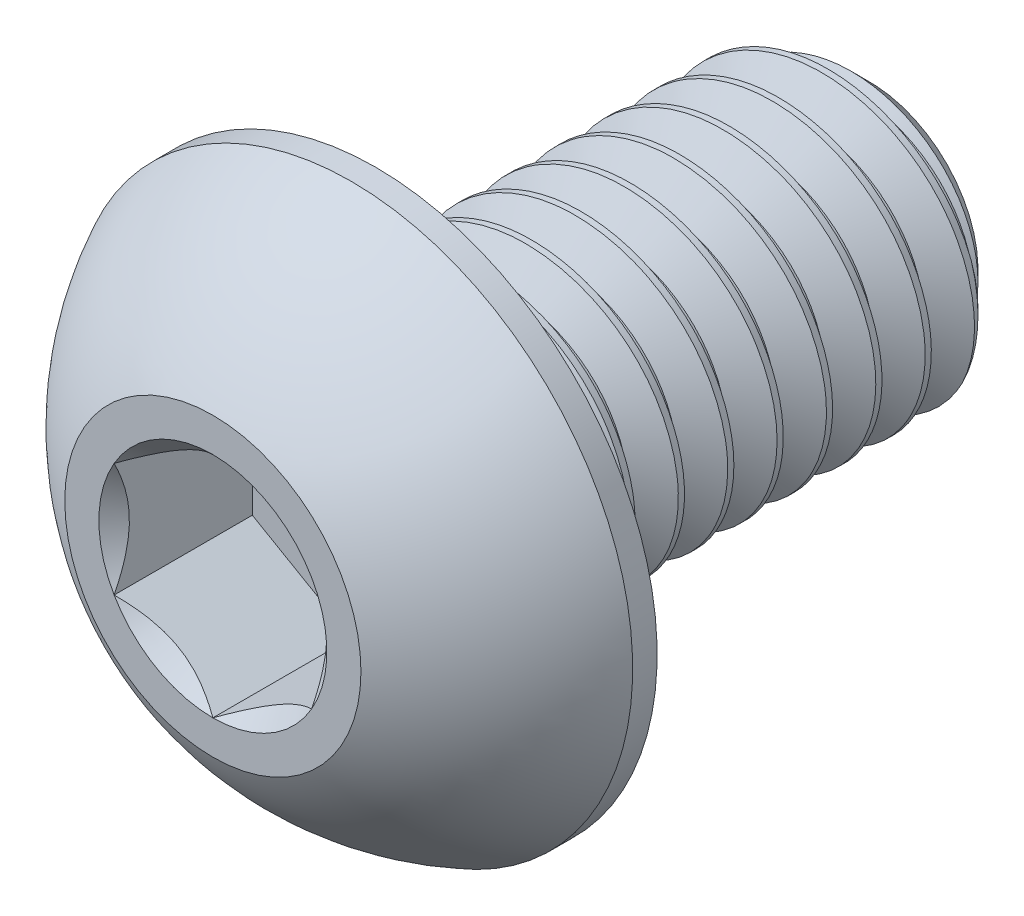
from build123d import *

# Parameters (mm, degrees)
CUT_EXTRUDE1_DEPTH = 1.4
CUT_SWEEP1_PITCH   = 0.5


# Read off the part's stored shape, not the designer's step: Split1
with BuildPart() as part:
    # Sketch2 → Revolve1 (revolve)
    with BuildSketch(Plane(origin=(0, 0, 0), x_dir=(0, 0, -1), z_dir=(1, 0, 0)), mode=Mode.PRIVATE) as revolve1_sk:
        with BuildLine():
            Line((-3.325, 0), (3.325, 0))
            Line((3.325, 0), (3.325, 1.1))
            Line((3.325, 1.1), (2.925, 1.5))
            Line((2.925, 1.5), (-1.675, 1.5))
            Line((-1.675, 1.5), (-1.675, 2.85))
            Line((-1.675, 2.85), (-1.9225, 2.85))
            ThreePointArc((-1.9225, 2.85), (-2.72987489, 2.285251969), (-3.325, 1.5))
            Line((-3.325, 1.5), (-3.325, 0))
        make_face()
    revolve(revolve1_sk.sketch.rotate(Axis((0, 0, 3.325), (0, 0, -1)), 180), axis=Axis((0, 0, 3.325), (0, 0, -1)))

    # Sketch3 → Cut-Extrude1 (cut)
    with BuildSketch(Plane.XY.offset(3.325)):
        Polygon((0, 1.154700538), (-1, 0.577350269), (-1, -0.577350269), (0, -1.154700538), (1, -0.577350269), (1, 0.577350269), align=None)
    extrude(amount=-CUT_EXTRUDE1_DEPTH, mode=Mode.SUBTRACT)

    # Cut-Extrude2 cone 1 section (through the dimple's axis) → Cut-Extrude2 (revolve, cut)
    with BuildSketch(Plane(origin=(0, 0, 3.325), x_dir=(0, -1, 0), z_dir=(1, 0, 0))):
        Polygon((0, 0), (1.154700538, 0), (0, 1.154700538), align=None)
    revolve(axis=Axis((0, 0, 3.325), (0, 0, -1)), mode=Mode.SUBTRACT)


with BuildPart() as body_2:
    # Split1: the piece on the far side of the plane
    add(part.part)
    split(bisect_by=Plane.XY.offset(1.675), keep=Keep.BOTTOM)

    # Cut-Sweep1: the profile of Sketch6 screwed along a right-hand helix of 11 turns, 6 arcs to a turn; built about Z, then put on its axis
    cut_sweep1_z = Axis((0, 0, 0), (0, 0, 1))
    cut_sweep1_corners = [(1.175240474, 0, -0.1875), (1.175240474, 0, -0.25), (1.527063294, 0, -0.453125), (1.527063294, 0, 0.015625)]
    with BuildLine(mode=Mode.PRIVATE) as cut_sweep1_profile:
        Line(cut_sweep1_corners[0], cut_sweep1_corners[1])
        Line(cut_sweep1_corners[1], cut_sweep1_corners[2])
        Line(cut_sweep1_corners[2], cut_sweep1_corners[3])
        Line(cut_sweep1_corners[3], cut_sweep1_corners[0])
    cut_sweep1_cap = Face(cut_sweep1_profile.wire())
    cut_sweep1_turn_angles = [0, 30, 60, 90, 120, 150, 180, 210, 240, 270, 300, 330, 360]
    cut_sweep1_turn_weights = [1, 0.8660254037844387, 1, 0.8660254037844387, 1, 0.8660254037844387, 1, 0.8660254037844387, 1, 0.8660254037844387, 1, 0.8660254037844387, 1]
    cut_sweep1_turn_rails = [Edge.make_bspline([Vector(p[0], p[1], 0).rotate(cut_sweep1_z, cut_sweep1_turn_angles[k]) / cut_sweep1_turn_weights[k] + Vector(0, 0, p[2] + CUT_SWEEP1_PITCH * cut_sweep1_turn_angles[k] / 360) for k in range(13)], [0, 0, 0, 1, 1, 2, 2, 3, 3, 4, 4, 5, 5, 6, 6, 6], 2, cut_sweep1_turn_weights) for p in cut_sweep1_corners]
    cut_sweep1_turn_sides = [Face.make_surface_from_curves(cut_sweep1_turn_rails[p[0]], cut_sweep1_turn_rails[p[1]]) for p in [(0, 1), (1, 2), (2, 3), (3, 0)]]
    cut_sweep1 = Plane(origin=(0, 0, -3.325), x_dir=(0, 1, 0), z_dir=(0, 0, 1)) * Solid(Shell([*[p.moved(Location((0, 0, CUT_SWEEP1_PITCH * i))) for i in range(11) for p in cut_sweep1_turn_sides], cut_sweep1_cap, cut_sweep1_cap.rotate(cut_sweep1_z, 3960).moved(Location((0, 0, CUT_SWEEP1_PITCH * 3960 / 360)))]))
    add(cut_sweep1, mode=Mode.SUBTRACT)


with BuildPart() as part_1:
    add(part.part)

    # Split1
    split(bisect_by=Plane.XY.offset(1.675), keep=Keep.TOP)

    add(body_2.part)  # Boss-Extrude1 merges body 2
    # Boss-Extrude1 cone 1 section (through the dimple's axis) → Boss-Extrude1 (revolve)
    with BuildSketch(Plane(origin=(0, 0, 1.675), x_dir=(0, -1, 0), z_dir=(1, 0, 0))):
        Polygon((0, 0), (1.5, 0), (0, 2.598076211), align=None)
    revolve(axis=Axis((0, 0, 1.675), (0, 0, -1)))


solid = part_1.part
